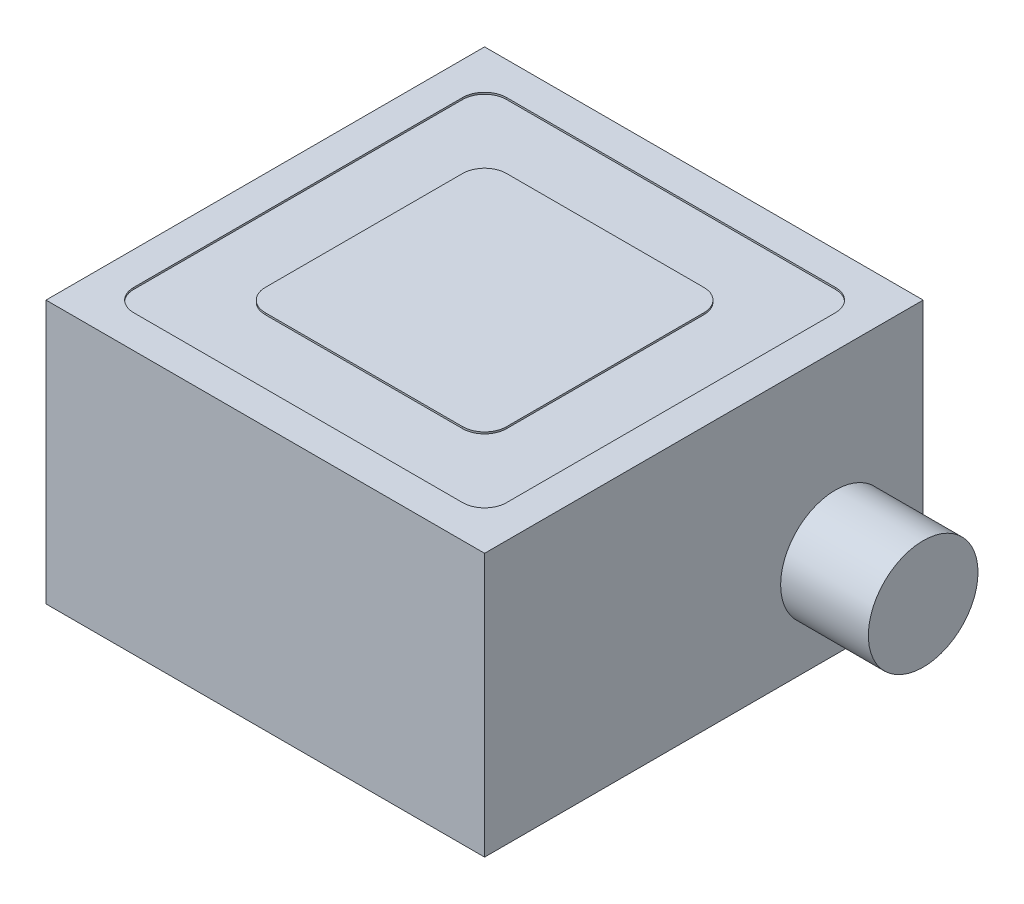
from build123d import *

# Parameters (mm, degrees)
SKETCH1_W                    = 63.5
SKETCH1_H                    = 63.5
BOSS_EXTRUDE1_DEPTH          = 38.1
CUT_EXTRUDE0_DEPTH           = 0.254
SKETCH3_R                    = 3.175
CUT_EXTRUDE1_DEPTH           = 12.7
SWEEP1_PITCH                 = 1.27
SKETCH6_R                    = 3.312481533
CUT_EXTRUDE2_OTHER_WAY_DEPTH = 81.5724675
BOSS_EXTRUDE2_START          = 76.2
SKETCH7_R                    = 7.9375
BOSS_EXTRUDE2_DEPTH          = 12.7


with BuildPart() as part:
    # Sketch1 → Boss-Extrude1 (new body)
    with BuildSketch(Plane(origin=(0, 0, 0), x_dir=(1, 0, 0), z_dir=(0, 1, 0))):
        with Locations((31.75, 0)):
            Rectangle(SKETCH1_W, SKETCH1_H)
    extrude(amount=BOSS_EXTRUDE1_DEPTH)

    # Sketch2 → Cut-Extrude0 (cut)
    with BuildSketch(Plane(origin=(0, 38.1, 0), x_dir=(1, 0, 0), z_dir=(0, 1, 0))):
        with BuildLine():
            Line((7.9375, 26.9875), (55.5625, 26.9875))
            ThreePointArc((55.5625, 26.9875), (57.80756403, 26.05756403), (58.7375, 23.8125))
            Line((58.7375, 23.8125), (58.7375, -23.8125))
            ThreePointArc((58.7375, -23.8125), (57.80756403, -26.05756403), (55.5625, -26.9875))
            Line((55.5625, -26.9875), (7.9375, -26.9875))
            ThreePointArc((7.9375, -26.9875), (5.69243597, -26.05756403), (4.7625, -23.8125))
            Line((4.7625, -23.8125), (4.7625, 23.8125))
            ThreePointArc((4.7625, 23.8125), (5.69243597, 26.05756403), (7.9375, 26.9875))
        make_face()
        with BuildLine():
            Line((17.4625, 17.4625), (46.0375, 17.4625))
            ThreePointArc((46.0375, 17.4625), (48.28256403, 16.53256403), (49.2125, 14.2875))
            Line((49.2125, 14.2875), (49.2125, -14.2875))
            ThreePointArc((49.2125, -14.2875), (48.28256403, -16.53256403), (46.0375, -17.4625))
            Line((46.0375, -17.4625), (17.4625, -17.4625))
            ThreePointArc((17.4625, -17.4625), (15.21743597, -16.53256403), (14.2875, -14.2875))
            Line((14.2875, -14.2875), (14.2875, 14.2875))
            ThreePointArc((14.2875, 14.2875), (15.21743597, 16.53256403), (17.4625, 17.4625))
        make_face(mode=Mode.SUBTRACT)
    extrude(amount=-CUT_EXTRUDE0_DEPTH, mode=Mode.SUBTRACT)

    # Sketch3 → Cut-Extrude1 (cut)
    with BuildSketch(Plane.XZ):
        with Locations(Location((31.75, 0, 0), (0, 0, 270))):
            Circle(SKETCH3_R)
    extrude(amount=-CUT_EXTRUDE1_DEPTH, mode=Mode.SUBTRACT)

    # Sweep1: the profile of Sketch5 screwed along a right-hand helix of 11 turns, 8 arcs to a turn; built about Z, then put on its axis
    sweep1_z = Axis((0, 0, 0), (0, 0, 1))
    sweep1_corners = [(3.243740766, 0, -1.1509375), (3.243740766, 0, 0.0396875), (2.487592336, 0, -0.396875), (2.487592336, 0, -0.714375)]
    with BuildLine(mode=Mode.PRIVATE) as sweep1_profile:
        Line(sweep1_corners[0], sweep1_corners[1])
        Line(sweep1_corners[1], sweep1_corners[2])
        Line(sweep1_corners[2], sweep1_corners[3])
        Line(sweep1_corners[3], sweep1_corners[0])
    sweep1_cap = Face(sweep1_profile.wire())
    sweep1_turn_angles = [0, 22.5, 45, 67.5, 90, 112.5, 135, 157.5, 180, 202.5, 225, 247.5, 270, 292.5, 315, 337.5, 360]
    sweep1_turn_weights = [1, 0.9238795325112867, 1, 0.9238795325112867, 1, 0.9238795325112867, 1, 0.9238795325112867, 1, 0.9238795325112867, 1, 0.9238795325112867, 1, 0.9238795325112867, 1, 0.9238795325112867, 1]
    sweep1_turn_rails = [Edge.make_bspline([Vector(p[0], p[1], 0).rotate(sweep1_z, sweep1_turn_angles[k]) / sweep1_turn_weights[k] + Vector(0, 0, p[2] + SWEEP1_PITCH * sweep1_turn_angles[k] / 360) for k in range(17)], [0, 0, 0, 1, 1, 2, 2, 3, 3, 4, 4, 5, 5, 6, 6, 7, 7, 8, 8, 8], 2, sweep1_turn_weights) for p in sweep1_corners]
    sweep1_turn_sides = [Face.make_surface_from_curves(sweep1_turn_rails[p[0]], sweep1_turn_rails[p[1]]) for p in [(0, 1), (1, 2), (2, 3), (3, 0)]]
    sweep1 = Plane(origin=(31.75, 0, 0), x_dir=(-1, 0, 0), z_dir=(0, 1, 0)) * Solid(Shell([*[p.moved(Location((0, 0, SWEEP1_PITCH * i))) for i in range(11) for p in sweep1_turn_sides], sweep1_cap, sweep1_cap.rotate(sweep1_z, 3960).moved(Location((0, 0, SWEEP1_PITCH * 3960 / 360)))]))
    add(sweep1)

    # Cut-Extrude2 cone 1 section (through the dimple's axis) → Cut-Extrude2 (revolve, cut)
    with BuildSketch(Plane(origin=(31.75, 0, 0), x_dir=(0, 0, -1), z_dir=(1, 0, 0))):
        Polygon((0, 0), (3.312481533, 0), (0, 3.312481533), align=None)
    revolve(axis=Axis((31.75, 0, 0), (0, 1, 0)), mode=Mode.SUBTRACT)

    # Sketch6 → Cut-Extrude2 other way (cut)
    with BuildSketch(Plane.XZ):
        with Locations((31.75, 0)):
            Circle(SKETCH6_R)
    extrude(amount=CUT_EXTRUDE2_OTHER_WAY_DEPTH, mode=Mode.SUBTRACT)

    # Sketch7 → Boss-Extrude2 (add)
    with BuildSketch(Plane(origin=(0, 0, 0), x_dir=(0, 0, -1), z_dir=(1, 0, 0)).offset(BOSS_EXTRUDE2_START)):
        with Locations((19.05, 12.7)):
            Circle(SKETCH7_R)
    extrude(amount=-BOSS_EXTRUDE2_DEPTH)


solid = part.part
